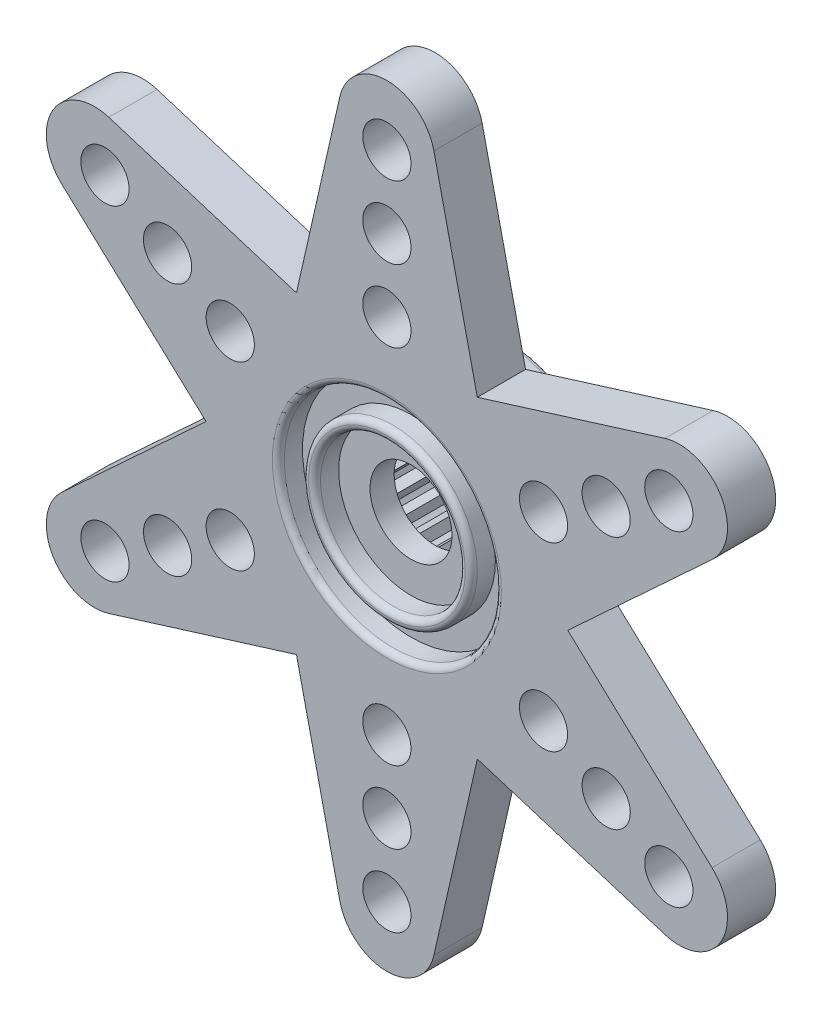
from build123d import *

# Parameters (mm, degrees)
ESQUISSE1_R                  = 4.25
ESQUISSE1_R_2                = 1.7
BOSS_EXTRU_1_DEPTH           = 5
ESQUISSE2_R                  = 3
ENL_V_MAT_EXTRU_1_DEPTH      = 3
BOSS_EXTRU_2_DEPTH           = 3
R_P_TITION_CIRCULAIRE1_DEPTH = 3
ESQUISSE4_R                  = 1
BOSS_EXTRU_3_DEPTH           = 2
R_P_TITION_CIRCULAIRE2_COUNT = 6
ENL_V_START                  = -1
ESQUISSE5_R                  = 3
ENL_V_MAT_EXTRU_2_DEPTH      = 1
CONG_1_R                     = 0.2
ESQUISSE6_R                  = 4.5
ESQUISSE6_R_2                = 3.5
ENL_V_MAT_EXTRU_3_DEPTH      = 1
CONG_2_R                     = 0.25


# Read off the part's stored shape, not the designer's step: Répétition circulaire1
with BuildPart() as part:
    # Esquisse1 → Boss.-Extru.1 (new body)
    with BuildSketch(Plane.XY):
        Circle(ESQUISSE1_R)
        Circle(ESQUISSE1_R_2, mode=Mode.SUBTRACT)
    extrude(amount=BOSS_EXTRU_1_DEPTH)

    # Esquisse2 → Enlèv. mat.-Extru.1 (cut)
    with BuildSketch(Plane(origin=(0, 0, 0), x_dir=(-1, 0, 0), z_dir=(0, 0, -1))):
        Circle(ESQUISSE2_R)
    extrude(amount=-ENL_V_MAT_EXTRU_1_DEPTH, mode=Mode.SUBTRACT)

    # Esquisse3 → Boss.-Extru.2 (add)
    with BuildSketch(Plane(origin=(0, 0, 0), x_dir=(-1, 0, 0), z_dir=(0, 0, -1))):
        Polygon((-0.3, 3), (0, 2.6), (0.3, 3), align=None)
    extrude(amount=-BOSS_EXTRU_2_DEPTH)

    # Répétition circulaire1 outline → Répétition circulaire1 (add)
    with BuildSketch(Plane.XY):
        with BuildLine():
            ThreePointArc((1.052468236, 2.80932565), (0.776457135, 2.897777479), (0.493198596, 2.959181499))
            Line((0.493198596, 2.959181499), (0.672929517, 2.511407148))
            Line((0.672929517, 2.511407148), (1.052468236, 2.80932565))
        make_face()
        with BuildLine():
            ThreePointArc((-0.493198596, 2.959181499), (-0.776457135, 2.897777479), (-1.052468236, 2.80932565))
            Line((-1.052468236, 2.80932565), (-0.672929517, 2.511407148))
            Line((-0.672929517, 2.511407148), (-0.493198596, 2.959181499))
        make_face()
        with BuildLine():
            ThreePointArc((-1.242285791, 2.730700645), (-1.5, 2.598076211), (-1.743713233, 2.441201376))
            Line((-1.743713233, 2.441201376), (-1.3, 2.25166605))
            Line((-1.3, 2.25166605), (-1.242285791, 2.730700645))
        make_face()
        with BuildLine():
            ThreePointArc((-1.906713263, 2.316127054), (-2.121320343, 2.121320343), (-2.316127054, 1.906713263))
            Line((-2.316127054, 1.906713263), (-1.838477631, 1.838477631))
            Line((-1.838477631, 1.838477631), (-1.906713263, 2.316127054))
        make_face()
        with BuildLine():
            ThreePointArc((-2.441201376, 1.743713233), (-2.598076211, 1.5), (-2.730700645, 1.242285791))
            Line((-2.730700645, 1.242285791), (-2.25166605, 1.3))
            Line((-2.25166605, 1.3), (-2.441201376, 1.743713233))
        make_face()
        with BuildLine():
            ThreePointArc((-2.809325651, 1.052468236), (-2.897777479, 0.776457135), (-2.959181499, 0.493198596))
            Line((-2.959181499, 0.493198596), (-2.511407148, 0.672929517))
            Line((-2.511407148, 0.672929517), (-2.809325651, 1.052468236))
        make_face()
        with BuildLine():
            ThreePointArc((-2.985999024, 0.289499268), (-3, 0), (-2.985999024, -0.289499268))
            Line((-2.985999024, -0.289499268), (-2.6, 0))
            Line((-2.6, 0), (-2.985999024, 0.289499268))
        make_face()
        with BuildLine():
            ThreePointArc((-2.959181499, -0.493198596), (-2.897777479, -0.776457135), (-2.809325651, -1.052468236))
            Line((-2.809325651, -1.052468236), (-2.511407148, -0.672929517))
            Line((-2.511407148, -0.672929517), (-2.959181499, -0.493198596))
        make_face()
        with BuildLine():
            ThreePointArc((-2.730700645, -1.242285791), (-2.598076211, -1.5), (-2.441201377, -1.743713233))
            Line((-2.441201377, -1.743713233), (-2.25166605, -1.3))
            Line((-2.25166605, -1.3), (-2.730700645, -1.242285791))
        make_face()
        with BuildLine():
            ThreePointArc((-2.316127055, -1.906713263), (-2.121320344, -2.121320344), (-1.906713263, -2.316127055))
            Line((-1.906713263, -2.316127055), (-1.838477631, -1.838477631))
            Line((-1.838477631, -1.838477631), (-2.316127055, -1.906713263))
        make_face()
        with BuildLine():
            ThreePointArc((-1.743713233, -2.441201377), (-1.5, -2.598076211), (-1.242285791, -2.730700645))
            Line((-1.242285791, -2.730700645), (-1.3, -2.25166605))
            Line((-1.3, -2.25166605), (-1.743713233, -2.441201377))
        make_face()
        with BuildLine():
            ThreePointArc((-1.052468236, -2.809325651), (-0.776457135, -2.897777479), (-0.493198596, -2.959181499))
            Line((-0.493198596, -2.959181499), (-0.672929517, -2.511407148))
            Line((-0.672929517, -2.511407148), (-1.052468236, -2.809325651))
        make_face()
        with BuildLine():
            ThreePointArc((-0.289499268, -2.985999024), (0, -3), (0.289499268, -2.985999024))
            Line((0.289499268, -2.985999024), (0, -2.6))
            Line((0, -2.6), (-0.289499268, -2.985999024))
        make_face()
        with BuildLine():
            ThreePointArc((0.493198596, -2.959181499), (0.776457135, -2.897777479), (1.052468236, -2.809325651))
            Line((1.052468236, -2.809325651), (0.672929517, -2.511407148))
            Line((0.672929517, -2.511407148), (0.493198596, -2.959181499))
        make_face()
        with BuildLine():
            ThreePointArc((1.242285791, -2.730700645), (1.5, -2.598076211), (1.743713233, -2.441201377))
            Line((1.743713233, -2.441201377), (1.3, -2.25166605))
            Line((1.3, -2.25166605), (1.242285791, -2.730700645))
        make_face()
        with BuildLine():
            ThreePointArc((1.906713263, -2.316127055), (2.121320344, -2.121320344), (2.316127055, -1.906713263))
            Line((2.316127055, -1.906713263), (1.838477631, -1.838477631))
            Line((1.838477631, -1.838477631), (1.906713263, -2.316127055))
        make_face()
        with BuildLine():
            ThreePointArc((2.441201377, -1.743713233), (2.598076211, -1.5), (2.730700645, -1.242285791))
            Line((2.730700645, -1.242285791), (2.25166605, -1.3))
            Line((2.25166605, -1.3), (2.441201377, -1.743713233))
        make_face()
        with BuildLine():
            ThreePointArc((2.809325651, -1.052468236), (2.897777479, -0.776457135), (2.959181499, -0.493198596))
            Line((2.959181499, -0.493198596), (2.511407148, -0.672929517))
            Line((2.511407148, -0.672929517), (2.809325651, -1.052468236))
        make_face()
        with BuildLine():
            ThreePointArc((2.985999024, -0.289499268), (3, 0), (2.985999024, 0.289499268))
            Line((2.985999024, 0.289499268), (2.6, 0))
            Line((2.6, 0), (2.985999024, -0.289499268))
        make_face()
        with BuildLine():
            ThreePointArc((2.959181499, 0.493198596), (2.897777479, 0.776457135), (2.809325651, 1.052468236))
            Line((2.809325651, 1.052468236), (2.511407148, 0.672929517))
            Line((2.511407148, 0.672929517), (2.959181499, 0.493198596))
        make_face()
        with BuildLine():
            ThreePointArc((2.730700645, 1.242285791), (2.598076211, 1.5), (2.441201376, 1.743713233))
            Line((2.441201376, 1.743713233), (2.25166605, 1.3))
            Line((2.25166605, 1.3), (2.730700645, 1.242285791))
        make_face()
        with BuildLine():
            ThreePointArc((2.316127054, 1.906713263), (2.121320343, 2.121320343), (1.906713263, 2.316127054))
            Line((1.906713263, 2.316127054), (1.838477631, 1.838477631))
            Line((1.838477631, 1.838477631), (2.316127054, 1.906713263))
        make_face()
        with BuildLine():
            ThreePointArc((1.743713233, 2.441201376), (1.5, 2.598076211), (1.242285791, 2.730700645))
            Line((1.242285791, 2.730700645), (1.3, 2.25166605))
            Line((1.3, 2.25166605), (1.743713233, 2.441201376))
        make_face()
    extrude(amount=R_P_TITION_CIRCULAIRE1_DEPTH)

    # Esquisse4 → Boss.-Extru.3 (add)
    with BuildSketch(Plane.XY.offset(5)):
        with BuildLine():
            Line((-1.95061736, 14.441692106), (-3.75, 6.495190528))
            Line((-3.75, 6.495190528), (-3.75, 2))
            Line((-3.75, 2), (0, 3.364888378))
            Line((0, 3.364888378), (3.75, 2))
            Line((3.75, 2), (3.75, 6.495190528))
            Line((3.75, 6.495190528), (1.95061736, 14.441692106))
            ThreePointArc((1.95061736, 14.441692106), (0, 16), (-1.95061736, 14.441692106))
        make_face()
        with Locations((0, 7.5)):
            Circle(ESQUISSE4_R, mode=Mode.SUBTRACT)
        with Locations((0, 10.5)):
            Circle(ESQUISSE4_R, mode=Mode.SUBTRACT)
        with Locations((0, 13.5)):
            Circle(ESQUISSE4_R, mode=Mode.SUBTRACT)
    boss_extru_3 = extrude(amount=-BOSS_EXTRU_3_DEPTH)

    # Répétition circulaire2: Boss.-Extru.3 ×6 about axis
    r_p_tition_circulaire2_axis = Axis((0, 0, 0), (0, 0, 1))
    for i in range(1, R_P_TITION_CIRCULAIRE2_COUNT):
        add(boss_extru_3.rotate(r_p_tition_circulaire2_axis, i * 360 / R_P_TITION_CIRCULAIRE2_COUNT))

    # Esquisse5 → Enlèv. mat.-Extru.2 (cut)
    with BuildSketch(Plane.XY.offset(5).offset(ENL_V_START)):
        Circle(ESQUISSE5_R)
    extrude(amount=ENL_V_MAT_EXTRU_2_DEPTH, mode=Mode.SUBTRACT)

    # Congé1
    cong_1_edges = [part.edges().sort_by_distance(p)[0] for p in [
        (-4.25, 0, 0),
    ]]
    fillet(cong_1_edges, radius=CONG_1_R)

    # Esquisse6 → Enlèv. mat.-Extru.3 (cut)
    with BuildSketch(Plane.XY.offset(5)):
        Circle(ESQUISSE6_R)
        Circle(ESQUISSE6_R_2, mode=Mode.SUBTRACT)
    extrude(amount=-ENL_V_MAT_EXTRU_3_DEPTH, mode=Mode.SUBTRACT)

    # Congé2
    cong_2_edges = [part.edges().sort_by_distance(p)[0] for p in [
        (-3, 0, 5),
        (-4.5, 0, 5),
        (-3.5, 0, 5),
    ]]
    fillet(cong_2_edges, radius=CONG_2_R - 0.0001)  # a hair under: the kernel refuses the full size


solid = part.part
